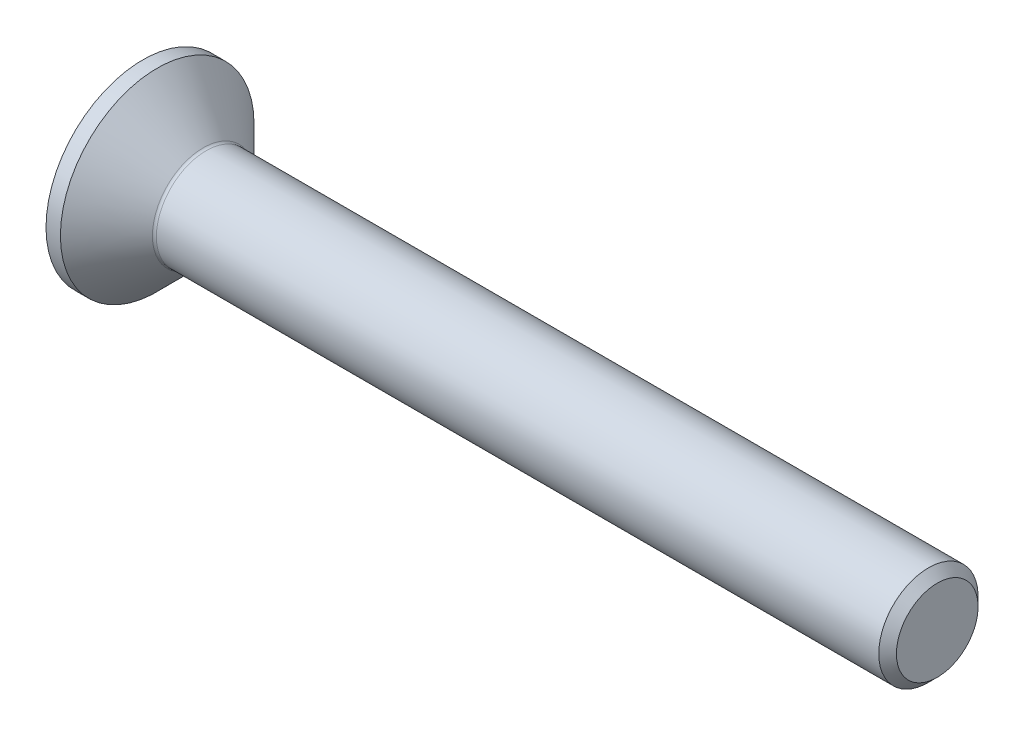
from build123d import *

# Parameters (mm, degrees)
FILLET1_R   = 0.2
HEX_START   = -1.9
HEX_2_DEPTH = 1.9


with BuildPart() as part:
    # BodySke → BaseBody (revolve)
    with BuildSketch(Plane.XY, mode=Mode.PRIVATE) as basebody_sk:
        Polygon((0, 0), (0, 4.875), (0.725, 4.875), (3.1, 2.5), (39.555, 2.5), (40, 2.055), (40, 0), align=None)
    revolve(basebody_sk.sketch.rotate(Axis((0, 0, 0), (1, 0, 0)), 90), axis=Axis((0, 0, 0), (1, 0, 0)))

    # Fillet1
    fillet1_edges = [part.edges().sort_by_distance(p)[0] for p in [
        (3.1, 0, -2.5),
    ]]
    fillet(fillet1_edges, radius=FILLET1_R)

    # Hex 2: read off the stored shape, not the designer's step
    # Hex 2 outline → Hex 2 (cut)
    with BuildSketch(Plane.ZY.offset(HEX_START)):
        Polygon((-1.5, -0.866025404), (0, -1.732050808), (1.5, -0.866025404), (1.5, 0.866025404), (0, 1.732050808), (-1.5, 0.866025404), align=None)
    extrude(amount=HEX_2_DEPTH, mode=Mode.SUBTRACT)

    # Hex 2 2 outline → Hex 2 2 (revolve, cut)
    with BuildSketch(Plane.YX):
        Polygon((1.5, 1.9), (0, 2.766025404), (0, 1.9), align=None)
    revolve(axis=Axis((0, 0, 0), (1, 0, 0)), mode=Mode.SUBTRACT)


solid = part.part
